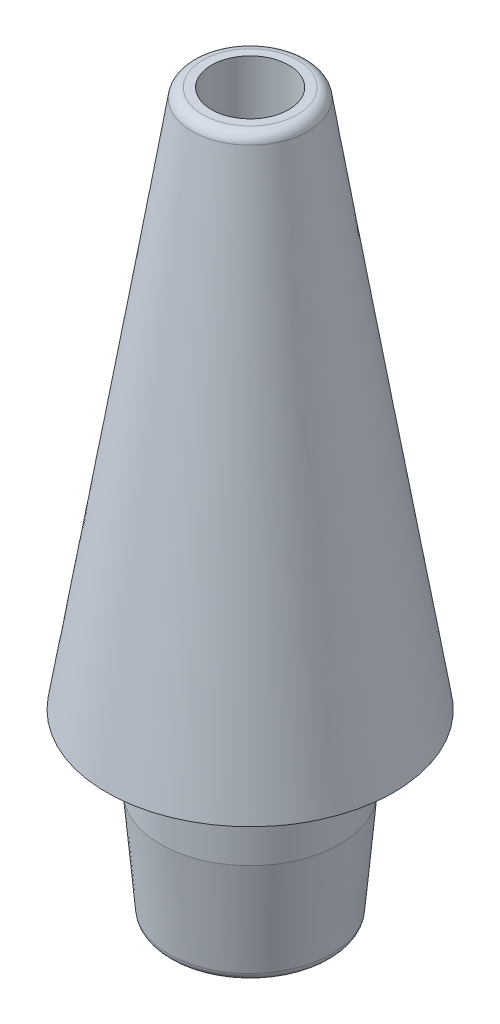
from build123d import *

# Parameters (mm, degrees)
SKETCH1_R           = 2.5
BOSS_EXTRUDE1_DEPTH = 5
SKETCH4_R           = 1.075
CUT_EXTRUDE1_DEPTH  = 21.784609729
CHAMFER1_SIZE       = 0.3
CHAMFER1_SIZE2      = 8.590875985
CHAMFER2_SIZE       = 3
CHAMFER2_SIZE2      = 0.262465991
FILLET1_R           = 0.3
FILLET2_R           = 0.25
FILLET4_R           = 0.25


with BuildPart() as part:
    # Sketch1 → Boss-Extrude1 (new body)
    with BuildSketch(Plane(origin=(0, 0, 0), x_dir=(1, 0, 0), z_dir=(0, 1, 0))):
        with Locations(Location((0, 0, 0), (0, 0, 270))):
            Circle(SKETCH1_R)
    extrude(amount=BOSS_EXTRUDE1_DEPTH)

    # Loft1: read off the stored shape, not the designer's step
    # Loft1: loft between two sections, ruled curve by curve
    loft1_from = [
        Edge.make_bspline([(-1.392393657, 20, -0.736114736), (0.079835815, 20, -3.52090205), (2.864623129, 20, -2.048672577), (1.392393657, 20, 0.736114736), (-0.079835815, 20, 3.52090205), (-2.864623129, 20, 2.048672577), (-1.392393657, 20, -0.736114736)], [0, 0, 0, 0, 0.5, 0.5, 0.5, 1, 1, 1, 1], 3, [1, 0.333333333, 0.333333333, 1, 0.333333333, 0.333333333, 1]),
    ]
    loft1_to = [
        Edge.make_bspline([(-3.843967333, 5, -1.106306985), (-1.631353363, 5, -8.79424165), (6.056581302, 5, -6.581627681), (3.843967333, 5, 1.106306985), (1.631353363, 5, 8.79424165), (-6.056581302, 5, 6.581627681), (-3.843967333, 5, -1.106306985)], [0, 0, 0, 0, 0.5, 0.5, 0.5, 1, 1, 1, 1], 3, [1, 0.333333333, 0.333333333, 1, 0.333333333, 0.333333333, 1]),
    ]
    loft1 = Solid(Shell([*[Face.make_surface_from_curves(loft1_from[k], loft1_to[k]) for k in range(1)], Face(Wire(loft1_from)), Face(Wire(loft1_to))]))
    add(loft1)

    # Sketch4 → Cut-Extrude1 (cut, through all)
    with BuildSketch(Plane(origin=(0, 20, 0), x_dir=(1, 0, 0), z_dir=(0, 1, 0))):
        with Locations(Location((0, 0, 0), (0, 0, 270))):
            Circle(SKETCH4_R)
    extrude(amount=-CUT_EXTRUDE1_DEPTH, mode=Mode.SUBTRACT)

    # Chamfer1
    chamfer1_edges = [part.edges().sort_by_distance(p)[0] for p in [
        (0, 0, -1.075),
    ]]
    chamfer1_side = [part.faces().sort_by_distance(p)[0] for p in [
        (0, 0, -2.429289322),
    ]]
    chamfer(chamfer1_edges, length=CHAMFER1_SIZE, length2=CHAMFER1_SIZE2, reference=chamfer1_side[0])

    # Chamfer2
    chamfer2_edges = [part.edges().sort_by_distance(p)[0] for p in [
        (0, 0, -2.5),
    ]]
    chamfer2_side = [part.faces().sort_by_distance(p)[0] for p in [
        (0, 2.5, -2.5),
    ]]
    chamfer(chamfer2_edges, length=CHAMFER2_SIZE, length2=CHAMFER2_SIZE2, reference=chamfer2_side[0])

    # Fillet1
    fillet1_edges = [part.edges().sort_by_distance(p)[0] for p in [
        (1.392393657, 20, 0.736114736),
    ]]
    fillet(fillet1_edges, radius=FILLET1_R)

    # Fillet2
    fillet2_edges = [part.edges().sort_by_distance(p)[0] for p in [
        (0, 5, -2.5),
    ]]
    fillet(fillet2_edges, radius=FILLET2_R)

    # Fillet4
    fillet4_edges = [part.edges().sort_by_distance(p)[0] for p in [
        (0, 0, -1.375),
        (0, 0, -2.237534009),
    ]]
    fillet(fillet4_edges, radius=FILLET4_R)


solid = part.part
